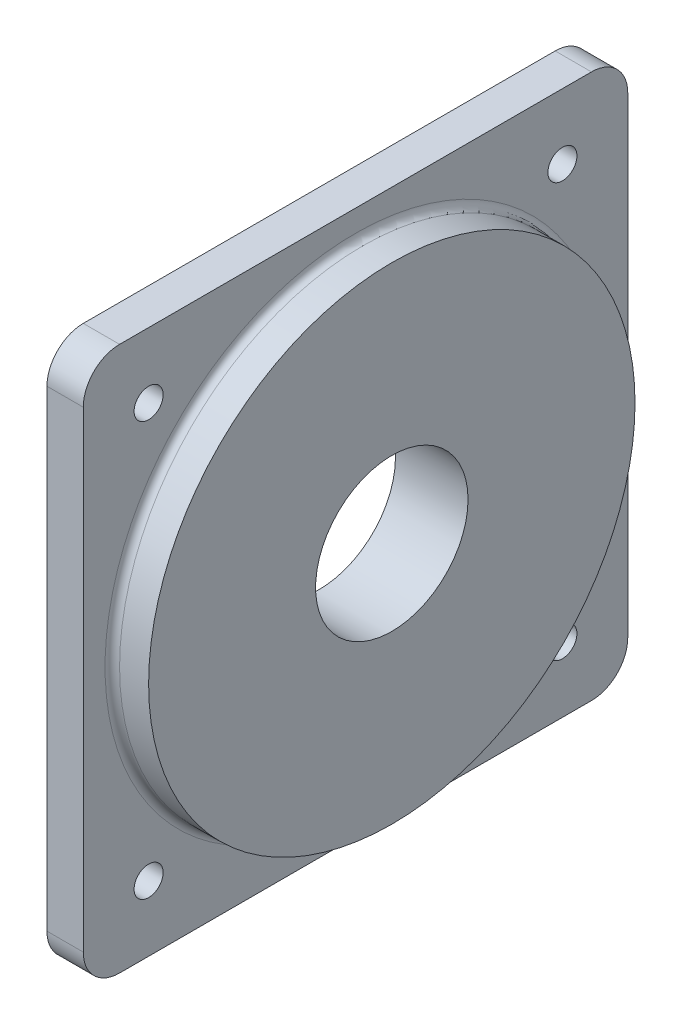
from build123d import *

# Parameters (mm, degrees)
CROQUIS1_W              = 150
CROQUIS1_H              = 150
SALIENTE_EXTRUIR1_DEPTH = 10
CROQUIS2_R              = 67
SALIENTE_EXTRUIR2_DEPTH = 10
REDONDEO1_R             = 10
REDONDEO2_R             = 2
CROQUIS3_R              = 21
CROQUIS3_R_2            = 4
CORTAR_EXTRUIR1_DEPTH   = 108.935165725


with BuildPart() as part:
    # Croquis1 → Saliente-Extruir1 (new body)
    with BuildSketch(Plane(origin=(0, 0, 0), x_dir=(0, 0, -1), z_dir=(1, 0, 0))):
        Rectangle(CROQUIS1_W, CROQUIS1_H)
    extrude(amount=SALIENTE_EXTRUIR1_DEPTH)

    # Croquis2 → Saliente-Extruir2 (add)
    with BuildSketch(Plane(origin=(10, 0, 0), x_dir=(0, 0, -1), z_dir=(1, 0, 0))):
        Circle(CROQUIS2_R)
    extrude(amount=SALIENTE_EXTRUIR2_DEPTH)

    # Redondeo1
    redondeo1_edges = [part.edges().sort_by_distance(p)[0] for p in [
        (5, -75, 75),
        (5, -75, -75),
        (5, 75, -75),
        (5, 75, 75),
    ]]
    fillet(redondeo1_edges, radius=REDONDEO1_R)

    # Redondeo2
    redondeo2_edges = [part.edges().sort_by_distance(p)[0] for p in [
        (10, 0, 67),
    ]]
    fillet(redondeo2_edges, radius=REDONDEO2_R)

    # Croquis3 → Cortar-Extruir1 (cut, through all)
    with BuildSketch(Plane(origin=(20, 0, 0), x_dir=(0, 0, -1), z_dir=(1, 0, 0))):
        Circle(CROQUIS3_R)
        with Locations((57, 57)):
            Circle(CROQUIS3_R_2)
        with Locations((57, -57)):
            Circle(CROQUIS3_R_2)
        with Locations((-57, -57)):
            Circle(CROQUIS3_R_2)
        with Locations((-57, 57)):
            Circle(CROQUIS3_R_2)
    extrude(amount=-CORTAR_EXTRUIR1_DEPTH, mode=Mode.SUBTRACT)


solid = part.part
